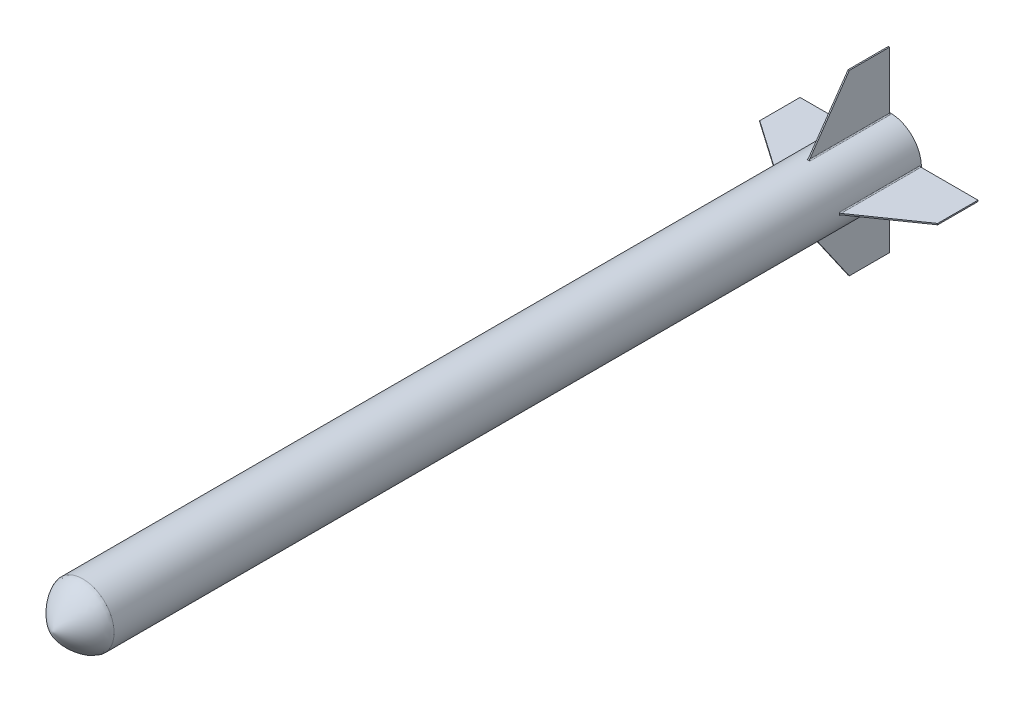
from build123d import *

# Parameters (mm, degrees)
SKETCH3_R                = 43.942
BOSS_EXTRUDE1_DEPTH      = 15.24
BOSS_EXTRUDE2_REACH      = 2156.162
BOSS_EXTRUDE2_END_RADIUS = 78.322932
SKETCH4_W                = 3.175
SKETCH4_H                = 203.2
CUT_EXTRUDE1_REACH       = 2145.535
FILLET1_R                = 2.54
CIRPATTERN1_COUNT        = 4
FILLET1_OF_CIRPATTERN1_R = 2.54


with BuildPart() as part:
    # Sketch2 → Revolve1 (revolve)
    with BuildSketch(Plane(origin=(0, 0, 0), x_dir=(0, 0, -1), z_dir=(1, 0, 0)), mode=Mode.PRIVATE) as revolve1_sk:
        with BuildLine():
            Line((76.2, 78.322932), (2111.6925, 78.322932))
            Line((2111.6925, 78.322932), (2111.6925, 0))
            Line((2111.6925, 0), (0, 0))
            add(Edge.make_bspline(
                [(0, 0), (0.00157185, 0.031106382), (0.00598179, 0.093218427), (0.019741162, 0.217041654), (0.056245749, 0.471623897), (0.120220676, 0.824555102), (0.289900607, 1.607620967), (0.681695021, 3.044497502), (1.369417811, 5.088592926), (2.663624448, 8.328390532), (4.627219491, 12.504828431), (7.221628503, 17.313832891), (10.478488809, 22.663697626), (14.048468312, 27.97193092), (17.830107282, 33.131203754), (21.803068789, 38.144384751), (25.954684106, 43.010577273), (30.277267993, 47.72553477), (34.76726888, 52.281456881), (39.424593478, 56.666373482), (44.252629149, 60.862995207), (49.25851273, 64.846416869), (54.379271658, 68.526766678), (59.025760285, 71.483086359), (63.137367168, 73.775059871), (66.620488281, 75.459145189), (69.291079417, 76.576884505), (71.652609302, 77.398960624), (73.545502358, 77.917349185), (74.790486934, 78.170322816), (75.589714748, 78.281706661), (75.99027716, 78.31490275), (76.130043485, 78.321823203), (76.2, 78.322932)],
                knots=[0, 0, 0, 0, 0, 0.00110147, 0.00220294, 0.004405879, 0.009096351, 0.013786822, 0.030539543, 0.057061285, 0.08533897, 0.137140357, 0.193696574, 0.250252697, 0.306809175, 0.363365414, 0.419921856, 0.476478205, 0.533034532, 0.589590952, 0.646147292, 0.702703654, 0.75926004, 0.815816409, 0.86911958, 0.89739782, 0.925675959, 0.952619519, 0.971471661, 0.985785918, 0.995050665, 0.997525332, 1, 1, 1, 1, 1], degree=4))
        make_face()
    revolve(revolve1_sk.sketch.rotate(Axis((0, 0, -2111.6925), (0, 0, 1)), 90), axis=Axis((0, 0, -2111.6925), (0, 0, 1)))

    # Sketch3 → Boss-Extrude1 (add)
    with BuildSketch(Plane(origin=(0, 0, -2111.6925), x_dir=(-1, 0, 0), z_dir=(0, 0, -1))):
        with Locations(Location((0, 0, 0), (0, 0, 270))):
            Circle(SKETCH3_R)
    extrude(amount=BOSS_EXTRUDE1_DEPTH)

    # Boss-Extrude2: up to this cylinder (the profile starts outside it)
    boss_extrude2_end = Plane(origin=(0, 0, -2006.9175), z_dir=(0, 0, -1)) * Cylinder(BOSS_EXTRUDE2_END_RADIUS, 4469.969864, mode=Mode.PRIVATE)
    # Sketch4 → Boss-Extrude2 (add, up to the surface)
    with BuildSketch(Plane(origin=(0, 254, 0), x_dir=(1, 0, 0), z_dir=(0, 1, 0)), mode=Mode.PRIVATE) as boss_extrude2_sk1:
        with Locations((0, 2006.9175)):
            Rectangle(SKETCH4_W, SKETCH4_H)
    boss_extrude2_tool1 = extrude(boss_extrude2_sk1.sketch, amount=-BOSS_EXTRUDE2_REACH, mode=Mode.PRIVATE) - boss_extrude2_end
    boss_extrude2 = boss_extrude2_tool1.solids().sort_by_distance((0, 254, -2006.9175))[0]
    add(boss_extrude2)

    # Sketch5 → Cut-Extrude1 (cut, up to next)
    with BuildSketch(Plane.ZY.offset(1.5875), mode=Mode.PRIVATE) as cut_extrude1_sk1:
        Polygon((-2108.5175, 224.356842107), (-2006.9175, 224.356842107), (-1905.3175, 78.306842107), (-1905.3175, 254), (-2108.5175, 254), align=None)
    cut_extrude1_tool1 = extrude(cut_extrude1_sk1.sketch, amount=-CUT_EXTRUDE1_REACH, mode=Mode.PRIVATE) & part.part
    cut_extrude1 = cut_extrude1_tool1.solids().sort_by_distance((-1.5875, 204.128915, -1969.534252))[0]
    add(cut_extrude1, mode=Mode.SUBTRACT)

    # Fillet1
    # the kernel refuses this fillet: 2.54 mm, written as the material it adds along each edge
    with BuildSketch(Plane(origin=(-1.5875, 78.306842107, -1899.190797857), x_dir=(-0.9993639751499004, -0.03566013422001241, 0), z_dir=(0, 0, -1))) as fillet1_piece_1_section:
        with BuildLine():
            CenterArc((2.450992889, 2.539698904), FILLET1_R, 182.043608468, 87.074170625)
            Line((-0.087391608, 2.449122163), (0, 0))
            ThreePointArc((0, 0), (1.205942189, 0.009284527), (2.411884379, 0))
        make_face()
    fillet1_piece_1 = extrude(amount=209.326702143, mode=Mode.PRIVATE)
    fillet1_piece_1 = split(fillet1_piece_1, bisect_by=Plane(origin=(-3.095055571, 78.248638535, -1905.277010558), z_dir=(0, -0.5710644881985995, -0.8209052017854874)), keep=Keep.TOP, mode=Mode.PRIVATE)
    add(fillet1_piece_1)
    with BuildSketch(Plane(origin=(1.5875, 78.306842107, -1899.190797857), x_dir=(0.9993639751499004, -0.035660134220013434, 0), z_dir=(0, 0, -1))) as fillet1_piece_2_section:
        with BuildLine():
            CenterArc((2.450992889, -2.539698904), FILLET1_R, 90.882220907, 87.074170625)
            Line((-0.087391608, -2.449122163), (0, 0))
            ThreePointArc((0, 0), (1.205942189, -0.009284527), (2.411884379, 0))
        make_face()
    fillet1_piece_2 = extrude(amount=209.326702143, mode=Mode.PRIVATE)
    fillet1_piece_2 = split(fillet1_piece_2, bisect_by=Plane(origin=(3.095055571, 78.248638535, -1905.277010558), z_dir=(0, -0.5710644881985995, -0.8209052017854874)), keep=Keep.TOP, mode=Mode.PRIVATE)
    add(fillet1_piece_2)

    # CirPattern1: Boss-Extrude2, Cut-Extrude1 ×4 about axis
    cirpattern1_axis = Axis((0, 0, 0), (0, 0, 1))
    add([boss_extrude2.rotate(cirpattern1_axis, i * 360 / CIRPATTERN1_COUNT) for i in range(1, CIRPATTERN1_COUNT)])
    add([cut_extrude1.rotate(cirpattern1_axis, i * 360 / CIRPATTERN1_COUNT) for i in range(1, CIRPATTERN1_COUNT)], mode=Mode.SUBTRACT)

    # Fillet1 of CirPattern1
    # the kernel refuses this fillet: 2.54 mm, written as the material it adds along each edge
    with BuildSketch(Plane(origin=(-78.306842107, -1.5875, -1899.190797857), x_dir=(0.03566013422001848, -0.9993639751499002, 0), z_dir=(0, 0, -1))) as fillet1_of_cirpattern1_piece_1_section:
        with BuildLine():
            CenterArc((2.450992889, 2.539698904), FILLET1_OF_CIRPATTERN1_R, 182.043608468, 87.074170625)
            Line((-0.087391608, 2.449122163), (0, 0))
            ThreePointArc((0, 0), (1.205942189, 0.009284527), (2.411884379, 0))
        make_face()
    fillet1_of_cirpattern1_piece_1 = extrude(amount=209.326702143, mode=Mode.PRIVATE)
    fillet1_of_cirpattern1_piece_1 = split(fillet1_of_cirpattern1_piece_1, bisect_by=Plane(origin=(-78.248638535, -3.095055571, -1905.277010558), z_dir=(0.5710644881985995, 0, -0.8209052017854874)), keep=Keep.TOP, mode=Mode.PRIVATE)
    add(fillet1_of_cirpattern1_piece_1)
    with BuildSketch(Plane(origin=(-78.306842107, 1.5875, -1899.190797857), x_dir=(0.03566013422001241, 0.9993639751499004, 0), z_dir=(0, 0, -1))) as fillet1_of_cirpattern1_piece_2_section:
        with BuildLine():
            CenterArc((2.450992889, -2.539698904), FILLET1_OF_CIRPATTERN1_R, 90.882220907, 87.074170625)
            Line((-0.087391608, -2.449122163), (0, 0))
            ThreePointArc((0, 0), (1.205942189, -0.009284527), (2.411884379, 0))
        make_face()
    fillet1_of_cirpattern1_piece_2 = extrude(amount=209.326702143, mode=Mode.PRIVATE)
    fillet1_of_cirpattern1_piece_2 = split(fillet1_of_cirpattern1_piece_2, bisect_by=Plane(origin=(-78.248638535, 3.095055571, -1905.277010558), z_dir=(0.5710644881985995, 0, -0.8209052017854874)), keep=Keep.TOP, mode=Mode.PRIVATE)
    add(fillet1_of_cirpattern1_piece_2)
    with BuildSketch(Plane(origin=(1.5875, -78.306842107, -1899.190797857), x_dir=(0.9993639751499002, 0.035660134220018555, 0), z_dir=(0, 0, -1))) as fillet1_of_cirpattern1_piece_3_section:
        with BuildLine():
            CenterArc((2.450992889, 2.539698904), FILLET1_OF_CIRPATTERN1_R, 182.043608468, 87.074170625)
            Line((-0.087391608, 2.449122163), (0, 0))
            ThreePointArc((0, 0), (1.205942189, 0.009284527), (2.411884379, 0))
        make_face()
    fillet1_of_cirpattern1_piece_3 = extrude(amount=209.326702143, mode=Mode.PRIVATE)
    fillet1_of_cirpattern1_piece_3 = split(fillet1_of_cirpattern1_piece_3, bisect_by=Plane(origin=(3.095055571, -78.248638535, -1905.277010558), z_dir=(0, 0.5710644881985995, -0.8209052017854874)), keep=Keep.TOP, mode=Mode.PRIVATE)
    add(fillet1_of_cirpattern1_piece_3)
    with BuildSketch(Plane(origin=(-1.5875, -78.306842107, -1899.190797857), x_dir=(-0.9993639751499004, 0.03566013422001239, 0), z_dir=(0, 0, -1))) as fillet1_of_cirpattern1_piece_4_section:
        with BuildLine():
            CenterArc((2.450992889, -2.539698904), FILLET1_OF_CIRPATTERN1_R, 90.882220907, 87.074170625)
            Line((-0.087391608, -2.449122163), (0, 0))
            ThreePointArc((0, 0), (1.205942189, -0.009284527), (2.411884379, 0))
        make_face()
    fillet1_of_cirpattern1_piece_4 = extrude(amount=209.326702143, mode=Mode.PRIVATE)
    fillet1_of_cirpattern1_piece_4 = split(fillet1_of_cirpattern1_piece_4, bisect_by=Plane(origin=(-3.095055571, -78.248638535, -1905.277010558), z_dir=(0, 0.5710644881985995, -0.8209052017854874)), keep=Keep.TOP, mode=Mode.PRIVATE)
    add(fillet1_of_cirpattern1_piece_4)
    with BuildSketch(Plane(origin=(78.306842107, 1.5875, -1899.190797857), x_dir=(-0.03566013422001829, 0.9993639751499002, 0), z_dir=(0, 0, -1))) as fillet1_of_cirpattern1_piece_5_section:
        with BuildLine():
            CenterArc((2.450992889, 2.539698904), FILLET1_OF_CIRPATTERN1_R, 182.043608468, 87.074170625)
            Line((-0.087391608, 2.449122163), (0, 0))
            ThreePointArc((0, 0), (1.205942189, 0.009284527), (2.411884379, 0))
        make_face()
    fillet1_of_cirpattern1_piece_5 = extrude(amount=209.326702143, mode=Mode.PRIVATE)
    fillet1_of_cirpattern1_piece_5 = split(fillet1_of_cirpattern1_piece_5, bisect_by=Plane(origin=(78.248638535, 3.095055571, -1905.277010558), z_dir=(-0.5710644881985995, 0, -0.8209052017854874)), keep=Keep.TOP, mode=Mode.PRIVATE)
    add(fillet1_of_cirpattern1_piece_5)
    with BuildSketch(Plane(origin=(78.306842107, -1.5875, -1899.190797857), x_dir=(-0.0356601342200124, -0.9993639751499004, 0), z_dir=(0, 0, -1))) as fillet1_of_cirpattern1_piece_6_section:
        with BuildLine():
            CenterArc((2.450992889, -2.539698904), FILLET1_OF_CIRPATTERN1_R, 90.882220907, 87.074170625)
            Line((-0.087391608, -2.449122163), (0, 0))
            ThreePointArc((0, 0), (1.205942189, -0.009284527), (2.411884379, 0))
        make_face()
    fillet1_of_cirpattern1_piece_6 = extrude(amount=209.326702143, mode=Mode.PRIVATE)
    fillet1_of_cirpattern1_piece_6 = split(fillet1_of_cirpattern1_piece_6, bisect_by=Plane(origin=(78.248638535, -3.095055571, -1905.277010558), z_dir=(-0.5710644881985995, 0, -0.8209052017854874)), keep=Keep.TOP, mode=Mode.PRIVATE)
    add(fillet1_of_cirpattern1_piece_6)


solid = part.part
